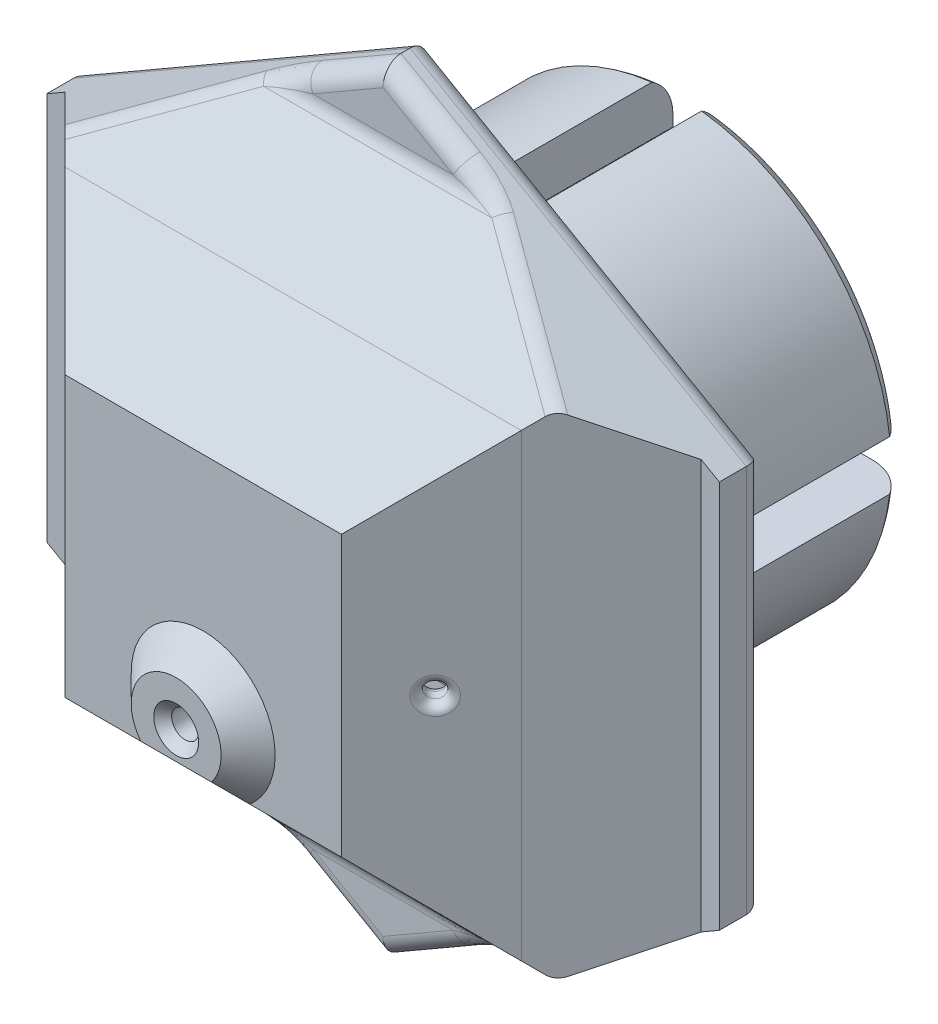
from build123d import *

# Parameters (mm, degrees)
BOSS_EXTRU_2_DEPTH       = 30
ESQUISSE2_W              = 50.74243014460133
ESQUISSE2_H              = 51.08038550187588
BOSS_EXTRU_4_DEPTH       = 25
CHANFREIN2_SIZE          = 10
COQUE1_T                 = -3
ESQUISSE3_R              = 1.0000000000000016
ENL_V_MAT_EXTRU_1_DEPTH  = 18.999999999999993
ESQUISSE4_R              = 1.0000000000000016
ENL_V_MAT_EXTRU_2_DEPTH  = 18.999999999999993
CONG_2_R                 = 1
ESQUISSE5_R              = 3.0000000000000004
BOSS_EXTRU_5_DEPTH       = 2.999999999999979
ESQUISSE6_R              = 1.4999999999999998
ENL_V_MAT_EXTRU_3_DEPTH  = 17.99999999999999
CHANFREIN4_SIZE          = 5
CHANFREIN5_SIZE          = 1
CHANFREIN6_SIZE          = 2
CONG_6_R                 = 1
ESQUISSE8_W              = 0.6690109743965102
ESQUISSE8_H              = 6.354056990368587
ENL_V_MAT_EXTRU_5_DEPTH  = 30
ESQUISSE9_W              = 5.520268398026409
ESQUISSE9_H              = 0.8310777650685104
ENL_V_MAT_EXTRU_6_DEPTH  = 30
CONG_7_R                 = 5
ESQUISSE10_R             = 26.53849307688144
ESQUISSE10_R_2           = 23.83849021769369
ENL_V_MAT_EXTRU_7_DEPTH  = 63.000000000000014
ESQUISSE11_R             = 36
BOSS_EXTRU_7_DEPTH       = 5.000000000000014
CHANFREIN7_SIZE          = 10
CONG_9_R                 = 2
CONG_10_R                = 2
ENL_V_MAT_EXTRU_4_DEPTH  = 30
ESQUISSE12_R             = 33.907721332477806
ESQUISSE12_R_2           = 25.838490217693693
ENL_V_MAT_EXTRU_10_DEPTH = 1.9999999999999967
CONG_11_R                = 10


with BuildPart() as part:
    # Esquisse1 → Boss.-Extru.2 (new body)
    with BuildSketch(Plane.XY):
        with BuildLine():
            Line((2.1, 18.2), (0, 18.2))
            Line((0, 18.2), (-2.1, 18.2))
            Line((-2.1, 18.2), (-2.100000000000001, 24.51020195755232))
            ThreePointArc((-2.0999999999998176, 24.510201957552304), (-17.394826817188882, 17.39482681718926), (-24.51020195755226, 2.1000000000003443))
            Line((-24.510201957552255, 2.100000000000258), (-18.19999999999998, 2.100000000000191))
            Line((-18.19999999999998, 2.100000000000191), (-18.20000000000002, -2.09999999999981))
            Line((-18.20000000000002, -2.0999999999998096), (-24.51020195755244, -2.0999999999997443))
            ThreePointArc((-24.510201957552376, -2.099999999998989), (-17.39482681718922, -17.39482681718892), (-2.09999999999941, -24.51020195755234))
            Line((-2.1000000000001733, -24.510201957552404), (-2.1000000000001284, -18.19999999999999))
            Line((-2.1000000000001284, -18.19999999999999), (2.0999999999998726, -18.200000000000014))
            Line((2.099999999999872, -18.200000000000014), (2.099999999999829, -24.510201957552287))
            ThreePointArc((2.0999999999999233, -24.510201957552294), (17.39482681718908, -17.394826817189056), (24.510201957552297, -2.099999999999912))
            Line((24.510201957552315, -2.1000000000000867), (18.199999999999996, -2.100000000000064))
            Line((18.199999999999996, -2.100000000000064), (18.20000000000001, 2.099999999999937))
            Line((18.20000000000001, 2.0999999999999366), (24.510201957552287, 2.0999999999999157))
            ThreePointArc((24.510201957552294, 2.099999999999969), (17.3948268171891, 17.394826817189042), (2.100000000000049, 24.510201957552283))
            Line((2.100000000000001, 24.510201957552283), (2.1, 18.2))
        make_face()
    extrude(amount=BOSS_EXTRU_2_DEPTH)

    # Esquisse2 → Boss.-Extru.4 (add)
    with BuildSketch(Plane.XY.offset(30)):
        Rectangle(ESQUISSE2_W, ESQUISSE2_H)
    extrude(amount=BOSS_EXTRU_4_DEPTH)

    # Chanfrein2
    chanfrein2_edges = [part.edges().sort_by_distance(p)[0] for p in [
        (25.371215072300657, -7.11e-15, 55),
        (-7.11e-15, 25.540192750937937, 55),
        (-25.371215072300675, -3.55e-15, 55),
        (-7.11e-15, -25.540192750937948, 55),
    ]]
    chamfer(chanfrein2_edges, length=CHANFREIN2_SIZE)

    # Coque1
    coque1_openings = [part.faces().sort_by_distance(p)[0] for p in [
        (0, 0, 0),
    ]]
    offset(amount=COQUE1_T, openings=coque1_openings, kind=Kind.INTERSECTION)

    # Esquisse3 → Enlèv. mat.-Extru.1 (cut)
    with BuildSketch(Plane(origin=(35.18560753615037, 2.39e-15, 35.185607536150215), x_dir=(0.7071067811865467, 0, -0.7071067811865485), z_dir=(0.7071067811865485, 0, 0.7071067811865467))):
        with Locations((-20.654061183379437, -1.041e-14)):
            Circle(ESQUISSE3_R)
    extrude(amount=-ENL_V_MAT_EXTRU_1_DEPTH, mode=Mode.SUBTRACT)

    # Esquisse4 → Enlèv. mat.-Extru.2 (cut)
    with BuildSketch(Plane(origin=(-35.18560753615038, 0, 35.185607536150236), x_dir=(0.7071067811865467, 0, 0.7071067811865485), z_dir=(-0.7071067811865485, 0, 0.7071067811865467))):
        with Locations((21.218086043732114, 0)):
            Circle(ESQUISSE4_R)
    extrude(amount=-ENL_V_MAT_EXTRU_2_DEPTH, mode=Mode.SUBTRACT)

    # Congé2
    cong_2_edges = [part.edges().sort_by_distance(p)[0] for p in [
        (17.75255368959477, -9.08e-15, 48.37602069558661),
        (19.873874033154394, -8.94e-15, 50.497341039146235),
        (-18.76794144845468, 1.2e-16, 47.360632936726695),
        (-20.88926179201432, 1.2e-16, 49.48195328028633),
    ]]
    fillet(cong_2_edges, radius=CONG_2_R)

    # Esquisse5 → Boss.-Extru.5 (add)
    with BuildSketch(Plane.XY.offset(55)):
        with Locations(Location((0, -9.43864650766197, 0), (0, 0, 180))):
            Circle(ESQUISSE5_R)
    extrude(amount=BOSS_EXTRU_5_DEPTH)

    # Esquisse6 → Enlèv. mat.-Extru.3 (cut)
    with BuildSketch(Plane.XY.offset(57.99999999999998)):
        with Locations((0, -9.43864650766197)):
            Circle(ESQUISSE6_R)
    extrude(amount=-ENL_V_MAT_EXTRU_3_DEPTH, mode=Mode.SUBTRACT)

    # Chanfrein4
    # the kernel refuses this chamfer: 5 mm, written as the material it adds along each edge
    with BuildSketch(Plane(origin=(0, -9.43864650766197, 55), x_dir=(-1, 0, 0), z_dir=(0, 1, 0))) as chanfrein4_piece_1_section:
        Polygon((3.0000000000000004 + CHANFREIN4_SIZE, 0), (3.0000000000000004, CHANFREIN4_SIZE), (3.0000000000000004, 0), align=None)
    chanfrein4_piece_1 = revolve(axis=Axis((0, -9.43864650766197, 55), (0, 0, 1)), mode=Mode.PRIVATE)
    chanfrein4_piece_1 = split(chanfrein4_piece_1, bisect_by=Plane(origin=(-5.910020738032422, -13.178827469907183, 57.361365281030764), z_dir=(0, 0.7071067811865476, -0.7071067811865476)), keep=Keep.TOP, mode=Mode.PRIVATE)
    chanfrein4_piece_1 = split(chanfrein4_piece_1, bisect_by=Plane(origin=(-5.910020738032422, -12.198853854945659, 57.99999999999998), z_dir=(0, 0, -1)), keep=Keep.TOP, mode=Mode.PRIVATE)
    add(chanfrein4_piece_1)

    # Chanfrein5
    chanfrein5_edges = [part.edges().sort_by_distance(p)[0] for p in [
        (-1.4999999999999998, -9.43864650766197, 57.99999999999998),
    ]]
    chamfer(chanfrein5_edges, length=CHANFREIN5_SIZE)

    # Chanfrein6
    chanfrein6_edges = [part.edges().sort_by_distance(p)[0] for p in [
        (-1.4999999999999998, -9.43864650766197, 52),
    ]]
    chamfer(chanfrein6_edges, length=CHANFREIN6_SIZE)

    # Congé6
    cong_6_edges = [part.edges().sort_by_distance(p)[0] for p in [
        (2.1000000000000254, 24.510201957552283, 15),
        (24.51020195755229, 2.0999999999999424, 15),
        (24.510201957552304, -2.1, 15),
        (2.099999999999876, -24.51020195755229, 15),
        (-2.099999999999791, -24.510201957552376, 15),
        (-24.51020195755241, -2.099999999999367, 15),
        (-24.510201957552255, 2.1000000000003034, 15),
        (-2.099999999999909, 24.51020195755231, 15),
    ]]
    fillet(cong_6_edges, radius=CONG_6_R)

    # Esquisse8 → Enlèv. mat.-Extru.5 (cut)
    with BuildSketch(Plane(origin=(0, 0, 0), x_dir=(-1, 0, 0), z_dir=(0, 0, -1))):
        with Locations((-2.434505487198255, 21.37702849518429)):
            Rectangle(ESQUISSE8_W, ESQUISSE8_H)
        with Locations((2.434505487198255, 21.37702849518429)):
            Rectangle(ESQUISSE8_W, ESQUISSE8_H)
        Polygon((18.200000000000006, 2.099999999999933), (24.554056990368593, 2.099999999999911), (24.554056990368597, 2.769010974396421), (18.20000000000001, 2.769010974396443), align=None)
        Polygon((24.55405699036858, -2.10000000000009), (24.554056990368576, -2.7690109743965996), (18.199999999999992, -2.7690109743965774), (18.199999999999996, -2.1000000000000676), align=None)
        Polygon((2.099999999999872, -18.200000000000014), (2.0999999999998282, -24.5540569903686), (2.769010974396338, -24.554056990368608), (2.7690109743963824, -18.20000000000002), align=None)
        Polygon((-2.1000000000001724, -24.554056990368572), (-2.769010974396682, -24.554056990368565), (-2.7690109743966382, -18.19999999999998), (-2.1000000000001284, -18.19999999999999), align=None)
        Polygon((-18.20000000000002, -2.0999999999998096), (-24.554056990368608, -2.099999999999743), (-24.554056990368615, -2.769010974396253), (-18.200000000000028, -2.7690109743963194), align=None)
        Polygon((-24.554056990368565, 2.1000000000002577), (-24.554056990368558, 2.7690109743967675), (-18.199999999999974, 2.769010974396701), (-18.19999999999998, 2.100000000000191), align=None)
    extrude(amount=-ENL_V_MAT_EXTRU_5_DEPTH, mode=Mode.SUBTRACT)

    # Esquisse9 → Enlèv. mat.-Extru.6 (cut)
    with BuildSketch(Plane(origin=(0, 0, 0), x_dir=(-1, 0, 0), z_dir=(0, 0, -1))):
        Polygon((17.368922234931496, 2.7690109743964477), (17.368922234931475, -2.751257423629961), (18.19999999999999, -2.751257423629964), (18.200000000000006, 2.7690109743964446), align=None)
        with Locations((-0.00887677538330589, 17.784461117465746)):
            Rectangle(ESQUISSE9_W, ESQUISSE9_H)
        Polygon((2.7690109743963887, -17.36892223493151), (-2.75125742363002, -17.368922234931468), (-2.7512574236300256, -18.19999999999998), (2.7690109743963833, -18.20000000000002), align=None)
        Polygon((-17.368922234931517, -2.7690109743963283), (-17.36892223493146, 2.7512574236300806), (-18.199999999999974, 2.7512574236300895), (-18.200000000000028, -2.7690109743963194), align=None)
    extrude(amount=-ENL_V_MAT_EXTRU_6_DEPTH, mode=Mode.SUBTRACT)

    # Congé7
    # the kernel refuses this fillet: 5 mm, written as the material it takes off along each edge
    with BuildSketch(Plane(origin=(-6.22e-15, 8.88e-15, 0), x_dir=(0.3677002559430734, 0.9299443648839419, 0), z_dir=(0.9299443648839419, -0.3677002559430734, 0))) as cong_7_piece_1:
        with BuildLine():
            CenterArc((24.60000000000031 - CONG_7_R, CONG_7_R), CONG_7_R, 270, 89.99999999999999)
            Line((24.600000000000314, CONG_7_R), (24.60000000000031, 0))
            Line((24.60000000000031, 0), (24.60000000000031 - CONG_7_R, 0))
        make_face()
    revolve(axis=Axis((-6.22e-15, 8.88e-15, 0), (0, 0, 1)), revolution_arc=133.14771169635816, mode=Mode.SUBTRACT)
    with BuildSketch(Plane(origin=(-1.066e-14, -1.155e-14, 0), x_dir=(-0.9299443648839381, 0.36770025594308337, 0), z_dir=(0.36770025594308337, 0.9299443648839381, 0))) as cong_7_piece_2:
        with BuildLine():
            CenterArc((24.600000000000314 - CONG_7_R, CONG_7_R), CONG_7_R, 270, 89.99999999999999)
            Line((24.600000000000314, CONG_7_R), (24.600000000000314, 0))
            Line((24.600000000000314, 0), (24.600000000000314 - CONG_7_R, 0))
        make_face()
    revolve(axis=Axis((-1.066e-14, -1.155e-14, 0), (0, 0, 1)), revolution_arc=133.14771169635898, mode=Mode.SUBTRACT)
    with BuildSketch(Plane(origin=(-9.77e-15, 1.243e-14, 0), x_dir=(-0.36770025594307887, -0.9299443648839398, 0), z_dir=(-0.9299443648839398, 0.36770025594307887, 0))) as cong_7_piece_3:
        with BuildLine():
            CenterArc((24.60000000000033 - CONG_7_R, CONG_7_R), CONG_7_R, 270, 89.99999999999999)
            Line((24.600000000000325, CONG_7_R), (24.60000000000033, 0))
            Line((24.60000000000033, 0), (24.60000000000033 - CONG_7_R, 0))
        make_face()
    revolve(axis=Axis((-9.77e-15, 1.243e-14, 0), (0, 0, 1)), revolution_arc=133.1477116963588, mode=Mode.SUBTRACT)
    with BuildSketch(Plane(origin=(6.22e-15, 2.66e-15, 0), x_dir=(0.9299443648839408, -0.36770025594307665, 0), z_dir=(-0.36770025594307665, -0.9299443648839408, 0))) as cong_7_piece_4:
        with BuildLine():
            CenterArc((24.600000000000318 - CONG_7_R, CONG_7_R), CONG_7_R, 270, 89.99999999999999)
            Line((24.600000000000318, CONG_7_R), (24.600000000000318, 0))
            Line((24.600000000000318, 0), (24.600000000000318 - CONG_7_R, 0))
        make_face()
    revolve(axis=Axis((6.22e-15, 2.66e-15, 0), (0, 0, 1)), revolution_arc=133.14771169635895, mode=Mode.SUBTRACT)

    # Esquisse10 → Enlèv. mat.-Extru.7 (cut)
    with BuildSketch(Plane(origin=(0, 0, 30), x_dir=(-1, 0, 0), z_dir=(0, 0, -1))):
        Circle(ESQUISSE10_R)
        Circle(ESQUISSE10_R_2, mode=Mode.SUBTRACT)
    extrude(amount=ENL_V_MAT_EXTRU_7_DEPTH, mode=Mode.SUBTRACT)

    # Esquisse11 → Boss.-Extru.7 (add)
    # profile 1 of 5: a face of its own
    with BuildSketch(Plane(origin=(0, 0, 30), x_dir=(-1, 0, 0), z_dir=(0, 0, -1))):
        Polygon((37.38879384149978, -21.586430189065315), (37.388793841499755, 21.58643018906534), (0, 43.17286037813064), (-37.38879384149978, 21.58643018906532), (-37.38879384149976, -21.586430189065336), (1.128e-14, -43.172860378130636), align=None)
        Circle(ESQUISSE11_R, mode=Mode.SUBTRACT)
    # profile 2 of 5: a face of its own
    with BuildSketch(Plane(origin=(0, 0, 30), x_dir=(-1, 0, 0), z_dir=(0, 0, -1))):
        with BuildLine():
            Line((-25.371215072300657, -25.540192750937944), (-25.371215072300657, 25.540192750937937))
            ThreePointArc((-25.371215072300668, 25.54019275093795), (-36, 4.41e-15), (-25.371215072300664, -25.540192750937955))
        make_face()
    # profile 3 of 5: a face of its own
    with BuildSketch(Plane(origin=(0, 0, 30), x_dir=(-1, 0, 0), z_dir=(0, 0, -1))):
        with BuildLine():
            ThreePointArc((25.371215072300675, 25.54019275093794), (2.2e-15, 36), (-25.371215072300668, 25.54019275093795))
            Line((-25.371215072300657, 25.540192750937937), (25.37121507230067, 25.540192750937937))
        make_face()
    # profile 4 of 5: a face of its own
    with BuildSketch(Plane(origin=(0, 0, 30), x_dir=(-1, 0, 0), z_dir=(0, 0, -1))):
        with BuildLine():
            ThreePointArc((36, 0), (33.236754825063954, 13.831779664908916), (25.371215072300675, 25.54019275093794))
            Line((25.371215072300675, 25.540192750937937), (25.371215072300675, -25.540192750937944))
            ThreePointArc((25.371215072300675, -25.54019275093794), (33.23675482506396, -13.831779664908906), (36, -8.82e-15))
        make_face()
    # profile 5 of 5: a face of its own
    with BuildSketch(Plane(origin=(0, 0, 30), x_dir=(-1, 0, 0), z_dir=(0, 0, -1))):
        with BuildLine():
            Line((25.37121507230067, -25.540192750937948), (-25.371215072300657, -25.540192750937948))
            ThreePointArc((-25.371215072300664, -25.540192750937955), (-6.61e-15, -36), (25.371215072300675, -25.54019275093794))
        make_face()
    extrude(amount=-BOSS_EXTRU_7_DEPTH)

    # Chanfrein7
    # the kernel refuses this chamfer: 10 mm, written as the material it adds along each edge
    with BuildSketch(Plane(origin=(51.08804495195976, 25.540192750937937, 35.000000000000014), x_dir=(0, 0.9996219169112968, -0.027495876610586327), z_dir=(-1, 0, 0))) as chanfrein7_piece_1_section:
        Polygon((CHANFREIN7_SIZE * 0.999621916911, -CHANFREIN7_SIZE * 0.0274958766106), (-CHANFREIN7_SIZE * 0.0274958766106, -CHANFREIN7_SIZE * 0.999621916911), (0, 0), align=None)
    chanfrein7_piece_1 = extrude(amount=102.17608990391953, mode=Mode.PRIVATE)
    chanfrein7_piece_1 = split(chanfrein7_piece_1, bisect_by=Plane(origin=(13.022938749859044, 50.69165757100177, 39.01859177584808), z_dir=(0.5, -0.8660254037844387, 0)), keep=Keep.TOP, mode=Mode.PRIVATE)
    chanfrein7_piece_1 = split(chanfrein7_piece_1, bisect_by=Plane(origin=(27.42347134910828, 27.33991181260899, 39.01859177584808), z_dir=(-0.5, -0.8660254037844387, 0)), keep=Keep.TOP, mode=Mode.PRIVATE)
    chanfrein7_piece_1 = split(chanfrein7_piece_1, bisect_by=Plane(origin=(29.15844834788206, 26.54455763282958, 41.2127667244186), z_dir=(-0.7071067811865476, 0, -0.7071067811865476)), keep=Keep.TOP, mode=Mode.PRIVATE)
    chanfrein7_piece_1 = split(chanfrein7_piece_1, bisect_by=Plane(origin=(-2.19417494857052, 26.544557632829584, 68.17704012373015), z_dir=(0.7071067811865476, 0, -0.7071067811865476)), keep=Keep.TOP, mode=Mode.PRIVATE)
    add(chanfrein7_piece_1)
    with BuildSketch(Plane(origin=(-25.371215072300675, 51.25702263059704, 35.000000000000014), x_dir=(-0.9996219169112968, 0, -0.027495876610586327), z_dir=(0, -1, 0))) as chanfrein7_piece_2_section:
        Polygon((CHANFREIN7_SIZE * 0.999621916911, -CHANFREIN7_SIZE * 0.0274958766106), (-CHANFREIN7_SIZE * 0.0274958766106, -CHANFREIN7_SIZE * 0.999621916911), (0, 0), align=None)
    chanfrein7_piece_2 = extrude(amount=102.5140452611941, mode=Mode.PRIVATE)
    chanfrein7_piece_2 = split(chanfrein7_piece_2, bisect_by=Plane(origin=(-27.42347134910829, 27.33991181260898, 39.01859177584808), z_dir=(0.5, -0.8660254037844387, 0)), keep=Keep.TOP, mode=Mode.PRIVATE)
    chanfrein7_piece_2 = split(chanfrein7_piece_2, bisect_by=Plane(origin=(-50.41173259135883, -14.067632996194185, 39.01859177584808), z_dir=(0.5000000000000001, 0.8660254037844386, 0)), keep=Keep.TOP, mode=Mode.PRIVATE)
    chanfrein7_piece_2 = split(chanfrein7_piece_2, bisect_by=Plane(origin=(-26.96427339931155, 29.033079303959717, 41.507113446978224), z_dir=(0, -0.7071067811865476, -0.7071067811865476)), keep=Keep.TOP, mode=Mode.PRIVATE)
    chanfrein7_piece_2 = split(chanfrein7_piece_2, bisect_by=Plane(origin=(-26.964273399311555, -2.4885216711301776, 68.05167107980782), z_dir=(0, 0.7071067811865476, -0.7071067811865476)), keep=Keep.TOP, mode=Mode.PRIVATE)
    add(chanfrein7_piece_2)
    with BuildSketch(Plane(origin=(25.371215072300664, -51.25702263059705, 35.000000000000014), x_dir=(0.9996219169112968, 0, -0.027495876610586317), z_dir=(0, 1, 0))) as chanfrein7_piece_3_section:
        Polygon((CHANFREIN7_SIZE * 0.999621916911, -CHANFREIN7_SIZE * 0.0274958766106), (-CHANFREIN7_SIZE * 0.0274958766106, -CHANFREIN7_SIZE * 0.999621916911), (0, 0), align=None)
    chanfrein7_piece_3 = extrude(amount=102.51404526119408, mode=Mode.PRIVATE)
    chanfrein7_piece_3 = split(chanfrein7_piece_3, bisect_by=Plane(origin=(50.41173259135882, 14.067632996194199, 39.01859177584808), z_dir=(-0.5, -0.8660254037844387, 0)), keep=Keep.TOP, mode=Mode.PRIVATE)
    chanfrein7_piece_3 = split(chanfrein7_piece_3, bisect_by=Plane(origin=(27.42347134910826, -27.339911812608996, 39.01859177584808), z_dir=(-0.49999999999999967, 0.8660254037844388, 0)), keep=Keep.TOP, mode=Mode.PRIVATE)
    chanfrein7_piece_3 = split(chanfrein7_piece_3, bisect_by=Plane(origin=(26.96427339931153, 2.4885216711301332, 68.0516710798078), z_dir=(0, -0.7071067811865476, -0.7071067811865476)), keep=Keep.TOP, mode=Mode.PRIVATE)
    chanfrein7_piece_3 = split(chanfrein7_piece_3, bisect_by=Plane(origin=(26.964273399311534, -29.03307930395976, 41.50711344697824), z_dir=(0, 0.7071067811865476, -0.7071067811865476)), keep=Keep.TOP, mode=Mode.PRIVATE)
    add(chanfrein7_piece_3)
    with BuildSketch(Plane(origin=(-51.08804495195977, -25.540192750937948, 35.000000000000014), x_dir=(0, -0.9996219169112968, -0.027495876610586317), z_dir=(1, 0, 0))) as chanfrein7_piece_4_section:
        Polygon((CHANFREIN7_SIZE * 0.999621916911, -CHANFREIN7_SIZE * 0.0274958766106), (-CHANFREIN7_SIZE * 0.0274958766106, -CHANFREIN7_SIZE * 0.999621916911), (0, 0), align=None)
    chanfrein7_piece_4 = extrude(amount=102.17608990391953, mode=Mode.PRIVATE)
    chanfrein7_piece_4 = split(chanfrein7_piece_4, bisect_by=Plane(origin=(-13.022938749859051, -50.691657571001755, 39.0185917758481), z_dir=(-0.49999999999999967, 0.8660254037844388, 0)), keep=Keep.TOP, mode=Mode.PRIVATE)
    chanfrein7_piece_4 = split(chanfrein7_piece_4, bisect_by=Plane(origin=(-27.42347134910827, -27.33991181260899, 39.0185917758481), z_dir=(0.5000000000000001, 0.8660254037844386, 0)), keep=Keep.TOP, mode=Mode.PRIVATE)
    chanfrein7_piece_4 = split(chanfrein7_piece_4, bisect_by=Plane(origin=(2.1941749485705024, -26.544557632829587, 68.17704012373015), z_dir=(-0.7071067811865476, 0, -0.7071067811865476)), keep=Keep.TOP, mode=Mode.PRIVATE)
    chanfrein7_piece_4 = split(chanfrein7_piece_4, bisect_by=Plane(origin=(-29.158448347882057, -26.54455763282959, 41.212766724418614), z_dir=(0.7071067811865476, 0, -0.7071067811865476)), keep=Keep.TOP, mode=Mode.PRIVATE)
    add(chanfrein7_piece_4)

    # Congé9
    cong_9_edges = [part.edges().sort_by_distance(p)[0] for p in [
        (18.199999999999974, 2.7601341990133954, 30),
        (-2.7601341990132044, 18.2, 30),
        (-18.199999999999992, -2.76013419901327, 30),
        (2.7601341990133323, -18.19999999999998, 30),
        (-2.7512574236298986, 17.784461117465746, 30),
        (0.00887677538330589, 17.36892223493149, 30),
        (-17.78446111746573, -2.7512574236299625, 30),
        (-17.368922234931485, 0.00887677538324327, 30),
        (2.7512574236300225, -17.784461117465725, 30),
        (-0.00887677538318465, -17.36892223493149, 30),
        (17.784461117465717, 2.751257423630085, 30),
        (17.36892223493149, -0.00887677538312381, 30),
        (-2.7690109743963647, -20.523023045364276, 30),
        (2.7690109743966573, -20.938561927898427, 30),
        (20.52302304536426, -2.769010974396294, 30),
        (20.93856192789844, 2.7690109743967297, 30),
        (2.769010974396508, 20.523023045364212, 30),
        (-2.7690109743965103, 20.93856192789843, 30),
        (-20.938561927898526, -2.769010974396587, 30),
        (-20.52302304536424, 2.769010974396434, 30),
        (-16.856358086180602, 16.856358086180165, 30),
        (16.856358086180293, 16.856358086180474, 30),
        (-16.856358086180368, -16.856358086180403, 30),
        (16.856358086180656, -16.856358086180112, 30),
        (-37.38879384149977, 1.066e-14, 30),
        (-18.694396920749877, 32.379645283597995, 30),
        (18.69439692074989, 32.37964528359798, 30),
        (37.388793841499776, -7.11e-15, 30),
        (18.694396920749874, -32.37964528359799, 30),
        (-18.694396920749895, -32.37964528359798, 30),
    ]]
    fillet(cong_9_edges, radius=CONG_9_R)

    # Congé10
    cong_10_edges = [part.edges().sort_by_distance(p)[0] for p in [
        (-6.610084063797089, -39.356526564531336, 35.000000000000014),
        (6.610084063797084, 39.35652656453134, 35.000000000000014),
        (6.610084063789653, -39.35652656453562, 35.000000000000014),
        (-6.61008406378966, 39.35652656453563, 35.000000000000014),
        (-9.89786e-12, -35.54019275093504, 34.999999999996),
        (9.89786e-12, 35.54019275093504, 34.999999999996),
        (20.241768648855412, 31.486269799843488, 39.05392295109091),
        (-20.24176864884263, 31.486269799840603, 39.053922951093796),
        (-20.241768648855412, -31.486269799843488, 39.05392295109091),
        (20.24176864884263, -31.4862697998406, 39.053922951093796),
    ]]
    fillet(cong_10_edges, radius=CONG_10_R)

    # Esquisse7 → Enlèv. mat.-Extru.4 (cut)
    with BuildSketch(Plane(origin=(0, 0, 0), x_dir=(-1, 0, 0), z_dir=(0, 0, -1))):
        with BuildLine():
            Line((-18.19999999999942, 2.6801705561036804), (-24.303115408064627, 2.6801705561036795))
            ThreePointArc((-24.30311540806497, 2.6801705561035223), (-23.934108043776757, 2.2574356274157217), (-23.39551239019997, 2.0999999999999184))
            Line((-23.39551239019997, 2.0999999999995365), (-18.19999999999942, 2.099999999999537))
            Line((-18.19999999999942, 2.099999999999537), (-18.19999999999942, 2.6801705561036804))
        make_face()
        with BuildLine():
            Line((-2.6801705561031035, -18.199999999999882), (-2.6801705561031026, -24.30311540806509))
            ThreePointArc((-2.6801705561032048, -24.30311540806487), (-2.257435627415569, -23.934108043776654), (-2.0999999999998353, -23.395512390199976))
            Line((-2.0999999999989596, -23.395512390199976), (-2.09999999999896, -18.199999999999882))
            Line((-2.09999999999896, -18.199999999999882), (-2.6801705561031035, -18.199999999999882))
        make_face()
        with BuildLine():
            Line((2.6801705561051845, -18.199999999999882), (2.1000000000010406, -18.199999999999882))
            Line((2.1000000000010406, -18.199999999999882), (2.100000000001042, -23.39551239019995))
            ThreePointArc((2.100000000000164, -23.39551239019995), (2.257435627416336, -23.934108043777297), (2.6801705561049944, -24.3031154080655))
            Line((2.6801705561051854, -24.30311540806509), (2.6801705561051845, -18.199999999999882))
        make_face()
        with BuildLine():
            Line((18.20000000000046, 2.6801705561047235), (18.20000000000046, 2.1000000000005796))
            Line((18.20000000000046, 2.1000000000005796), (23.395512390199944, 2.10000000000058))
            ThreePointArc((23.395512390199944, 2.100000000000245), (23.934108043777186, 2.25743562741635), (24.303115408065388, 2.6801705561048514))
            Line((24.303115408065665, 2.6801705561047235), (18.20000000000046, 2.6801705561047235))
        make_face()
        with BuildLine():
            Line((2.6801705561041445, 18.2), (2.680170556104144, 24.303115408065207))
            ThreePointArc((2.6801705561041436, 24.303115408065207), (2.2574356274159633, 23.934108043776998), (2.0999999999999988, 23.39551239019996))
            Line((2.1, 23.39551239019996), (2.1, 18.2))
            Line((2.1, 18.2), (2.6801705561041445, 18.2))
        make_face()
        with BuildLine():
            Line((-2.6801705561041445, 18.2), (-2.1, 18.2))
            Line((-2.1, 18.2), (-2.1, 23.39551239019996))
            ThreePointArc((-2.1000000000000014, 23.39551239019996), (-2.2574356274159664, 23.934108043776995), (-2.6801705561041445, 24.303115408065207))
            Line((-2.680170556104144, 24.303115408065207), (-2.6801705561041445, 18.2))
        make_face()
        Polygon((-18.19999999999942, -2.6801705561046076), (-24.303115408064627, -2.6801705561046085), (-24.303115408064627, -2.100000000000465), (-18.19999999999942, -2.1000000000004637), align=None)
        Polygon((18.20000000000046, -2.6801705561035645), (24.30311540806567, -2.6801705561035645), (24.30311540806567, -2.0999999999994214), (18.20000000000046, -2.099999999999421), align=None)
    extrude(amount=-ENL_V_MAT_EXTRU_4_DEPTH, mode=Mode.SUBTRACT)

    # Esquisse12 → Enlèv. mat.-Extru.10 (cut)
    with BuildSketch(Plane(origin=(0, 0, 30), x_dir=(-1, 0, 0), z_dir=(0, 0, -1))):
        Circle(ESQUISSE12_R)
        Circle(ESQUISSE12_R_2, mode=Mode.SUBTRACT)
    extrude(amount=-ENL_V_MAT_EXTRU_10_DEPTH, mode=Mode.SUBTRACT)

    # Congé11
    # the kernel refuses this fillet: 10 mm, written as the material it adds along each edge
    with BuildSketch(Plane(origin=(0, 0, 31.999999999999996), x_dir=(-1, 0, 0), z_dir=(0, -1, 0))) as cong_11_piece_1:
        with BuildLine():
            CenterArc((27.907721332477177, 10), CONG_11_R, 270, 36.86989764584689)
            Line((27.907721332477177, 0), (27.907721332477177, -0.1999999999999993))
            Line((27.907721332477177, -0.1999999999999993), (33.907721332477806, -0.1999999999999993))
            Line((33.907721332477806, -0.1999999999999993), (34.10772133247781, 0))
            ThreePointArc((34.10772133247781, 0), (34.10772133247781, 1.0000000000001528), (34.02772133247758, 1.840000000000309))
            Line((34.02772133247758, 1.840000000000309), (33.90772133247758, 2.000000000000302))
        make_face()
    revolve(axis=Axis((0, 0, 31.999999999999996), (0, 0, -1)))


solid = part.part
